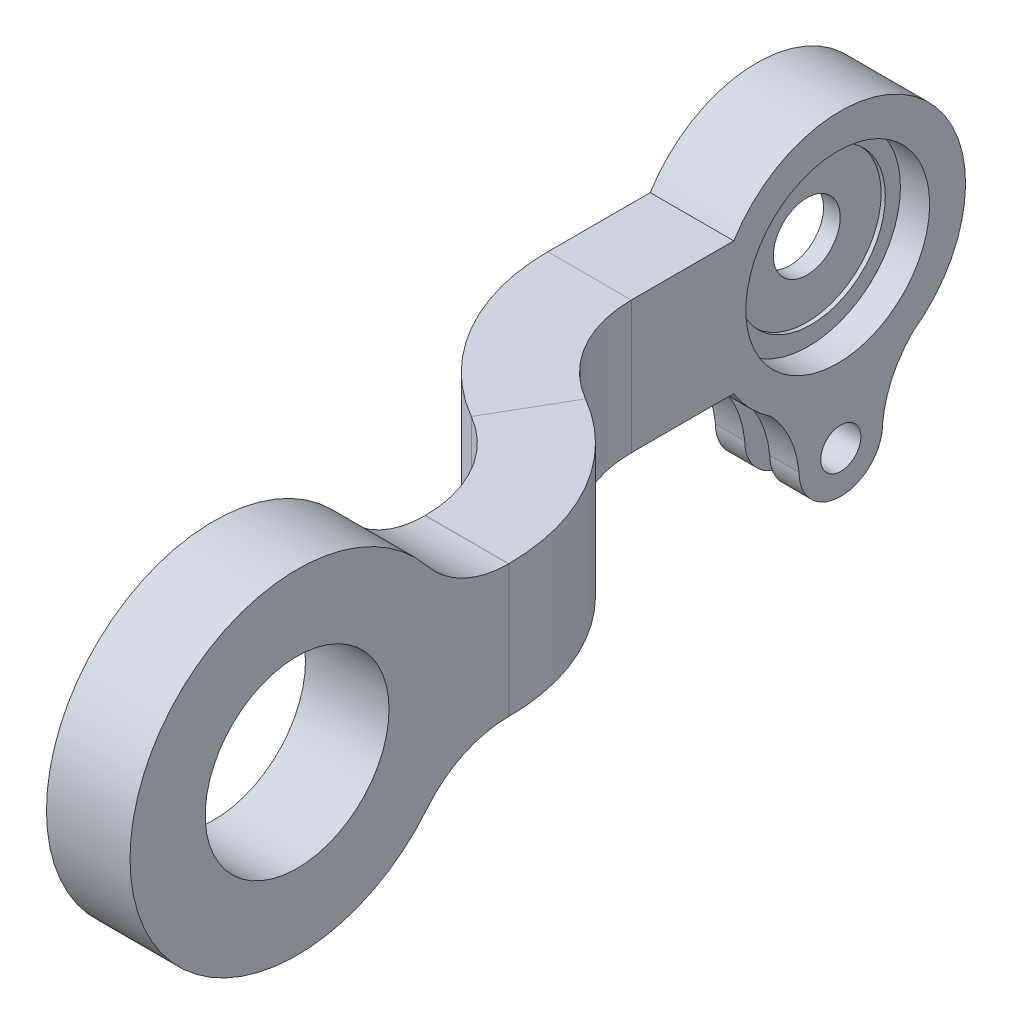
from build123d import *

# Parameters (mm, degrees)
CROQUIS2_W              = 10
CROQUIS2_H              = 15.834903248
CROQUIS4_R              = 15
SALIENTE_EXTRUIR1_DEPTH = 10
CROQUIS5_R              = 20
SALIENTE_EXTRUIR2_DEPTH = 10
SALIENTE_EXTRUIR5_DEPTH = 3.5
CROQUIS13_R             = 2.5
CORTAR_EXTRUIR1_DEPTH   = 10
SIMETR_A3_COPY_1_DEPTH  = 3.5
SIMETR_A3_COPY_2_DEPTH  = 3.5
CORTAR_EXTRUIR5_DEPTH   = 10
CROQUIS21_R             = 2.4
CORTAR_EXTRUIR6_DEPTH   = 10
CROQUIS7_R              = 11
CORTAR_EXTRUIR7_DEPTH   = 10
REDONDEO1_R             = 12.5
REDONDEO2_R             = 12.5
CROQUIS22_R             = 11.5
CORTAR_EXTRUIR8_DEPTH   = 4
CROQUIS6_R              = 4
CORTAR_EXTRUIR9_DEPTH   = 8
CROQUIS23_R             = 11
CORTAR_EXTRUIR10_DEPTH  = 4
CROQUIS24_R             = 11.295388062
CROQUIS24_R_2           = 8.9
SALIENTE_EXTRUIR6_DEPTH = 0.5
SALIENTE_EXTRUIR7_START = 0.5
CROQUIS25_R             = 11.5
CROQUIS25_R_2           = 8.9
SALIENTE_EXTRUIR7_DEPTH = 0.5


with BuildPart() as part:
    # Barrer1: sweep along a path in Croquis1
    with BuildLine(Plane(origin=(0, 0, 0), x_dir=(1, 0, 0), z_dir=(0, 1, 0))) as barrer1_path:
        Line((-20, 85), (-20, 60))
        ThreePointArc((-20, 60), (-17.320508076, 50), (-10, 42.679491924))
        ThreePointArc((-10, 42.679491924), (-2.679491924, 35.358983849), (0, 25.358983849))
        Line((0, 25.358983849), (0, 0))
    # Croquis2 → Barrer1 (sweep)
    with BuildSketch(Plane.XY):
        Rectangle(CROQUIS2_W, CROQUIS2_H)
    sweep(path=barrer1_path.line)

    # Croquis4 → Saliente-Extruir1 (add)
    with BuildSketch(Plane(origin=(-15, 0, 0), x_dir=(0, 0, -1), z_dir=(1, 0, 0))):
        with Locations((85, 0)):
            Circle(CROQUIS4_R)
    extrude(amount=-SALIENTE_EXTRUIR1_DEPTH)

    # Croquis5 → Saliente-Extruir2 (add)
    with BuildSketch(Plane(origin=(5, 0, 0), x_dir=(0, 0, -1), z_dir=(1, 0, 0))):
        Circle(CROQUIS5_R)
    extrude(amount=-SALIENTE_EXTRUIR2_DEPTH)

    # Croquis12 → Saliente-Extruir5 (add)
    with BuildSketch(Plane(origin=(-15, 0, 0), x_dir=(0, 0, -1), z_dir=(1, 0, 0))):
        with BuildLine():
            ThreePointArc((90.068496439, 19.972615481), (85.068496439, 24.972615481), (80.068496439, 19.972615481))
            add(Edge.make_bspline(
                [(80.068496439, 19.972615481), (79.566731031, 15.028252388), (75.848465439, 11.643922813)],
                knots=[0, 0, 0, 1, 1, 1], degree=2))
            ThreePointArc((75.848465439, 11.643922813), (85.068496439, 14.846363713), (94.288527439, 11.643922813))
            add(Edge.make_bspline(
                [(90.068496439, 19.972615481), (90.570261847, 15.028252388), (94.288527439, 11.643922813)],
                knots=[0, 0, 0, 1, 1, 1], degree=2))
        make_face()
    saliente_extruir5 = extrude(amount=-SALIENTE_EXTRUIR5_DEPTH)

    # Simetría1: Saliente-Extruir5 across plane
    add(saliente_extruir5.mirror(Plane(origin=(-20, 0, 0), x_dir=(0, 0, 1), z_dir=(1, 0, 0))))

    # Croquis13 → Cortar-Extruir1 (cut)
    with BuildSketch(Plane(origin=(-15, 0, 0), x_dir=(0, 0, -1), z_dir=(1, 0, 0))):
        with Locations((85.068496439, 19.972615481)):
            Circle(CROQUIS13_R)
    extrude(amount=-CORTAR_EXTRUIR1_DEPTH, mode=Mode.SUBTRACT)

    # Simetría3 copy 1 sketch → Simetría3 copy 1 (add)
    with BuildSketch(Plane(origin=(-25, 0, 0), x_dir=(0, 0, -1), z_dir=(-1, 0, 0))):
        with BuildLine():
            ThreePointArc((90.068496439, 19.972615481), (85.068496439, 24.972615481), (80.068496439, 19.972615481))
            add(Edge.make_bspline(
                [(80.068496439, 19.972615481), (79.566731031, 15.028252388), (75.848465439, 11.643922813)],
                knots=[0, 0, 0, 1, 1, 1], degree=2))
            ThreePointArc((75.848465439, 11.643922813), (85.068496439, 14.846363713), (94.288527439, 11.643922813))
            add(Edge.make_bspline(
                [(90.068496439, 19.972615481), (90.570261847, 15.028252388), (94.288527439, 11.643922813)],
                knots=[0, 0, 0, 1, 1, 1], degree=2))
        make_face()
    extrude(amount=-SIMETR_A3_COPY_1_DEPTH)

    # Simetría3 copy 2 sketch → Simetría3 copy 2 (add)
    with BuildSketch(Plane(origin=(-15, 0, 0), x_dir=(0, 0, -1), z_dir=(1, 0, 0))):
        with BuildLine():
            ThreePointArc((90.068496439, -19.972615481), (85.068496439, -24.972615481), (80.068496439, -19.972615481))
            add(Edge.make_bspline(
                [(80.068496439, -19.972615481), (79.566731031, -15.028252388), (75.848465439, -11.643922813)],
                knots=[0, 0, 0, 1, 1, 1], degree=2))
            ThreePointArc((75.848465439, -11.643922813), (85.068496439, -14.846363713), (94.288527439, -11.643922813))
            add(Edge.make_bspline(
                [(90.068496439, -19.972615481), (90.570261847, -15.028252388), (94.288527439, -11.643922813)],
                knots=[0, 0, 0, 1, 1, 1], degree=2))
        make_face()
    extrude(amount=-SIMETR_A3_COPY_2_DEPTH)

    # Croquis20 → Cortar-Extruir5 (cut)
    with BuildSketch(Plane(origin=(-15, 0, 0), x_dir=(0, 0, -1), z_dir=(1, 0, 0))):
        with BuildLine():
            Line((75.916830569, 25.735778906), (95.172377376, 25.735778906))
            Line((95.172377376, 25.735778906), (95.172377376, 11.023735234))
            ThreePointArc((95.172377376, 11.023735234), (85.710763224, 14.983151058), (75.916830569, 11.93717023))
            Line((75.916830569, 11.93717023), (75.916830569, 25.735778906))
        make_face()
    extrude(amount=-CORTAR_EXTRUIR5_DEPTH, mode=Mode.SUBTRACT)

    # Croquis21 → Cortar-Extruir6 (cut)
    with BuildSketch(Plane.ZY.offset(25)):
        with Locations((-85.068496439, -19.972615481)):
            Circle(CROQUIS21_R)
    extrude(amount=-CORTAR_EXTRUIR6_DEPTH, mode=Mode.SUBTRACT)

    # Croquis7 → Cortar-Extruir7 (cut)
    with BuildSketch(Plane(origin=(5, 0, 0), x_dir=(0, 0, -1), z_dir=(1, 0, 0))):
        Circle(CROQUIS7_R)
    extrude(amount=-CORTAR_EXTRUIR7_DEPTH, mode=Mode.SUBTRACT)

    # Redondeo1
    redondeo1_edges = [part.edges().sort_by_distance(p)[0] for p in [
        (0, -7.917451624, -18.366108999),
    ]]
    fillet(redondeo1_edges, radius=REDONDEO1_R)

    # Redondeo2
    redondeo2_edges = [part.edges().sort_by_distance(p)[0] for p in [
        (0, 7.917451624, -18.366108999),
    ]]
    fillet(redondeo2_edges, radius=REDONDEO2_R)

    # Croquis22 → Cortar-Extruir8 (cut)
    with BuildSketch(Plane.ZY.offset(25)):
        with Locations((-85, 0)):
            Circle(CROQUIS22_R)
    extrude(amount=-CORTAR_EXTRUIR8_DEPTH, mode=Mode.SUBTRACT)

    # Croquis6 → Cortar-Extruir9 (cut)
    with BuildSketch(Plane(origin=(-15, 0, 0), x_dir=(0, 0, -1), z_dir=(1, 0, 0))):
        with Locations((85, 0)):
            Circle(CROQUIS6_R)
    extrude(amount=-CORTAR_EXTRUIR9_DEPTH, mode=Mode.SUBTRACT)

    # Croquis23 → Cortar-Extruir10 (cut)
    with BuildSketch(Plane(origin=(-15, 0, 0), x_dir=(0, 0, -1), z_dir=(1, 0, 0))):
        with Locations((84.704611938, 0)):
            Circle(CROQUIS23_R)
    extrude(amount=-CORTAR_EXTRUIR10_DEPTH, mode=Mode.SUBTRACT)

    # Croquis24 → Saliente-Extruir6 (add)
    with BuildSketch(Plane(origin=(-19, 0, 0), x_dir=(0, 0, -1), z_dir=(1, 0, 0))):
        with Locations((85, 0)):
            Circle(CROQUIS24_R)
        with Locations((85, 0)):
            Circle(CROQUIS24_R_2, mode=Mode.SUBTRACT)
    extrude(amount=SALIENTE_EXTRUIR6_DEPTH)

    # Croquis25 → Saliente-Extruir7 (add)
    with BuildSketch(Plane.ZY.offset(21).offset(SALIENTE_EXTRUIR7_START)):
        with Locations((-85, 0)):
            Circle(CROQUIS25_R)
        with Locations((-85, 0)):
            Circle(CROQUIS25_R_2, mode=Mode.SUBTRACT)
    extrude(amount=-SALIENTE_EXTRUIR7_DEPTH)


solid = part.part
